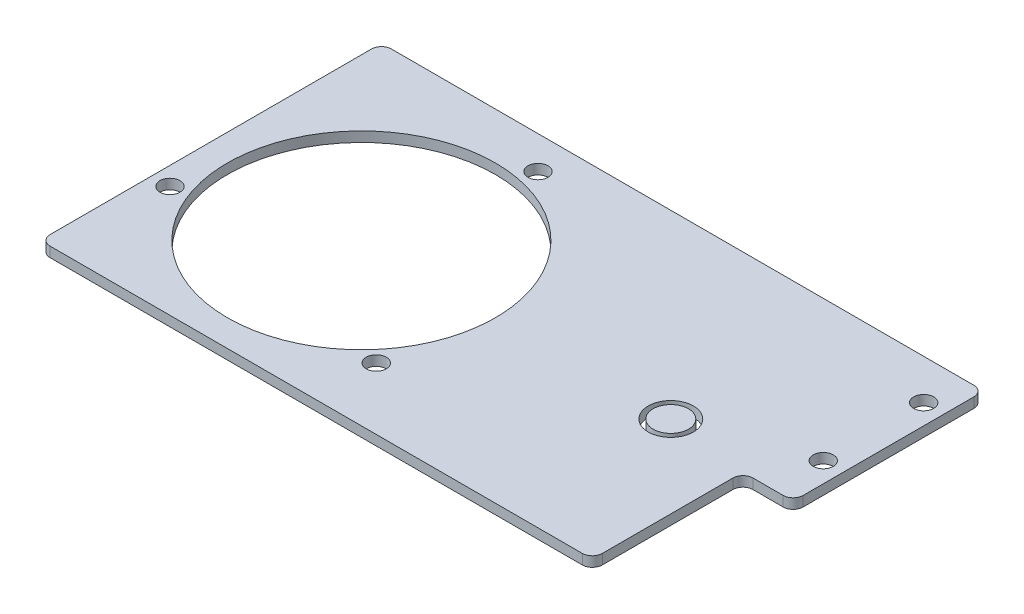
from build123d import *

# Parameters (mm, degrees)
SKETCH1_R           = 84.7725
SKETCH1_R_2         = 6.35
BOSS_EXTRUDE1_DEPTH = 6.35
SKETCH4_R           = 14.2875
SKETCH4_R_2         = 11.176
CUT_EXTRUDE1_DEPTH  = 9.652


with BuildPart() as part:
    # Sketch1 → Boss-Extrude1 (new body)
    with BuildSketch(Plane(origin=(0, 0, 0), x_dir=(1, 0, 0), z_dir=(0, 1, 0))):
        with BuildLine():
            Line((273.05, 114.3), (-95.25, 114.3))
            ThreePointArc((-95.25, 114.3), (-99.740128061, 112.440128061), (-101.6, 107.95))
            Line((-101.6, 107.95), (-101.6, -95.25))
            ThreePointArc((-101.6, -95.25), (-99.740128061, -99.740128061), (-95.25, -101.6))
            Line((-95.25, -101.6), (241.3, -101.6))
            ThreePointArc((241.3, -101.6), (245.790128061, -99.740128061), (247.65, -95.25))
            Line((247.65, -95.25), (247.65, -12.7))
            ThreePointArc((247.65, -12.7), (249.509871939, -8.209871939), (254, -6.35))
            Line((254, -6.35), (273.05, -6.35))
            ThreePointArc((273.05, -6.35), (277.540128061, -4.490128061), (279.4, 0))
            Line((279.4, 0), (279.4, 107.95))
            ThreePointArc((279.4, 107.95), (277.540128061, 112.440128061), (273.05, 114.3))
        make_face()
        Circle(SKETCH1_R, mode=Mode.SUBTRACT)
        with Locations((-90.060644326, -31.010366712)):
            Circle(SKETCH1_R_2, mode=Mode.SUBTRACT)
        with Locations((18.17455681, 93.499989223)):
            Circle(SKETCH1_R_2, mode=Mode.SUBTRACT)
        with Locations((71.886087516, -62.489622511)):
            Circle(SKETCH1_R_2, mode=Mode.SUBTRACT)
        with Locations((266.7, 88.9)):
            Circle(SKETCH1_R_2, mode=Mode.SUBTRACT)
        with Locations((266.7, 25.4)):
            Circle(SKETCH1_R_2, mode=Mode.SUBTRACT)
    extrude(amount=BOSS_EXTRUDE1_DEPTH)

    # Sketch4 → Cut-Extrude1 (cut)
    with BuildSketch(Plane(origin=(0, 6.35, 0), x_dir=(1, 0, 0), z_dir=(0, 1, 0))):
        with Locations((195.68668, 0)):
            Circle(SKETCH4_R)
        with Locations((195.68668, 0)):
            Circle(SKETCH4_R_2, mode=Mode.SUBTRACT)
    extrude(amount=-CUT_EXTRUDE1_DEPTH, mode=Mode.SUBTRACT)


with BuildPart() as cut_extrude1_piece_1:
    # of the separate pieces the step leaves, piece 1, a body of its own (cut_extrude1_pieces)
    add(part.part.solids().sort_by_distance((273.05, 0, -114.3))[0])


with BuildPart() as cut_extrude1_piece_2:
    # of the separate pieces the step leaves, piece 2, a body of its own (cut_extrude1_pieces)
    add(part.part.solids().sort_by_distance((206.86268, 0, 0))[0])


solid = Compound([cut_extrude1_piece_1.part, cut_extrude1_piece_2.part])
